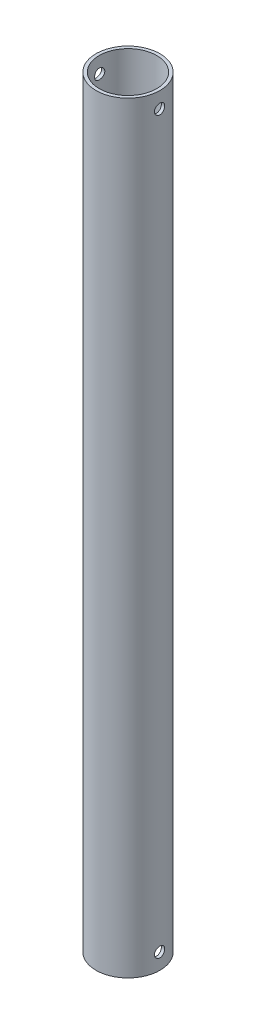
from build123d import *

# Parameters (mm, degrees)
SKETCH1_R            = 10
SKETCH1_R_2          = 9
BOSS_EXTRUDE1_DEPTH  = 238.5
M3_CLEARANCE_HOLE1_D = 3.2


with BuildPart() as part:
    # Sketch1 → Boss-Extrude1 (new body)
    with BuildSketch(Plane(origin=(0, 0, 0), x_dir=(1, 0, 0), z_dir=(0, 1, 0))):
        Circle(SKETCH1_R)
        Circle(SKETCH1_R_2, mode=Mode.SUBTRACT)
    extrude(amount=BOSS_EXTRUDE1_DEPTH)

    # M3 Clearance Hole1 (through all)
    with Locations(Plane.ZY.offset(10)):
        with Locations((0, 5)):
            m3_clearance_hole1 = Hole(M3_CLEARANCE_HOLE1_D / 2)

    # Mirror1: M3 Clearance Hole1 across plane
    add(m3_clearance_hole1.mirror(Plane.ZX.offset(119.25)), mode=Mode.SUBTRACT)


solid = part.part
